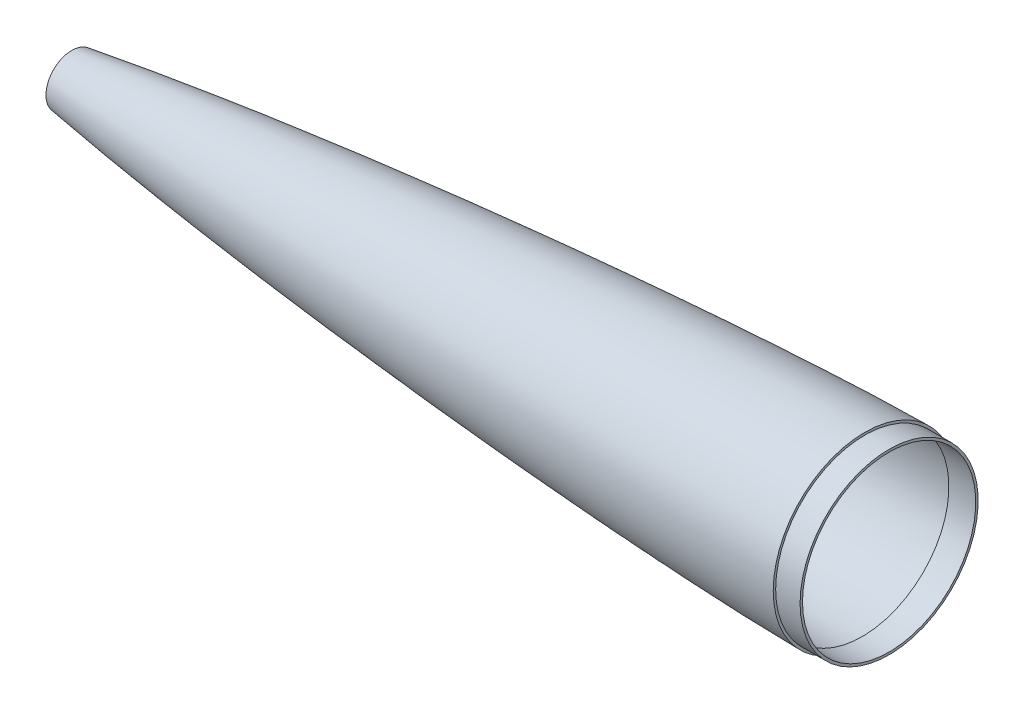
from build123d import *

# Parameters (mm, degrees)
CUT_EXTRUDE1_REACH = 680.348
SKETCH4_R          = 75


with BuildPart() as part:
    # Sketch2 → Revolve1 (revolve)
    with BuildSketch(Plane.XY):
        with BuildLine():
            Line((750.00497269, 75), (750, 75))
            add(Edge.make_bspline(
                [(0, 0), (0.002661369, 0.00735768), (0.009108664, 0.021455176), (0.026858739, 0.047022825), (0.06841925, 0.093346235), (0.131428409, 0.1510252), (0.216810716, 0.21833703), (0.338162364, 0.304110587), (0.48394243, 0.397396692), (0.655054985, 0.498068807), (0.851568565, 0.605626998), (1.137654509, 0.753350528), (1.581543682, 0.966113556), (2.335050733, 1.296122672), (3.682901567, 1.826629283), (6.111473252, 2.674476309), (10.574628301, 4.037968264), (18.951733743, 6.252001296), (33.570100518, 9.565304084), (58.406653249, 14.407879587), (92.507874052, 20.12088369), (133.842049801, 26.225056743), (179.809214733, 32.306451647), (225.84209313, 37.86321125), (271.925422623, 42.983912816), (318.04912254, 47.72529812), (364.207064366, 52.120679156), (410.394737335, 56.191009866), (456.609131982, 59.945893406), (502.84798368, 63.386478656), (549.109760477, 66.50424795), (595.393392595, 69.279792224), (635.910176338, 71.377324916), (670.6520208, 72.898528506), (698.66827638, 73.906563077), (717.52848444, 74.458019085), (733.022602025, 74.804058757), (742.723636447, 74.948033977), (747.57448889, 74.993969324), (750, 75)],
                knots=[0, 0, 0, 0, 0, 4.1103e-05, 8.2207e-05, 0.000164413, 0.000328826, 0.000493239, 0.000657652, 0.000951494, 0.001245335, 0.001544792, 0.001844249, 0.002657057, 0.00385252, 0.005901677, 0.009515863, 0.016280764, 0.028569004, 0.051793804, 0.088907366, 0.150314205, 0.211721038, 0.273127872, 0.334534706, 0.395941541, 0.457348376, 0.518755211, 0.580162046, 0.641568881, 0.702975716, 0.764382551, 0.825789386, 0.887196222, 0.917899639, 0.948603057, 0.974301528, 0.987150764, 1, 1, 1, 1, 1], degree=4))
            Line((0, 0), (17.824636248, 0))
            add(Edge.make_bspline(
                [(17.824636248, 0), (17.827359821, 0.007438315), (17.83394352, 0.021685181), (17.85200756, 0.047505996), (17.894329621, 0.094207173), (17.946659869, 0.141803874), (18.00793283, 0.191078994), (18.083660244, 0.247216772), (18.181771032, 0.315046273), (18.316852614, 0.400745464), (18.491162199, 0.502339064), (18.691437236, 0.610907618), (18.985657603, 0.761336609), (19.446495181, 0.979763892), (20.243699921, 1.324403347), (21.683492291, 1.881589923), (24.318644814, 2.782982784), (29.21451122, 4.240833208), (38.455862174, 6.611511049), (54.987751035, 10.230228493), (81.828623639, 15.247893158), (117.893812964, 21.05165355), (160.925453146, 27.155265251), (207.678359496, 33.103632305), (254.493219278, 38.533920173), (301.357126925, 43.530168516), (348.258583686, 48.144605296), (395.195517807, 52.408605556), (442.157521049, 56.340458763), (489.151953975, 59.947817327), (536.159738144, 63.228580383), (583.207792217, 66.170919541), (630.245909701, 68.74857003), (668.532144057, 70.510188265), (697.913196576, 71.631136519), (718.60463903, 72.282916745), (730.184819299, 72.607163808), (739.336592405, 72.821554583), (745.131881071, 72.938779632), (748, 72.991017275)],
                knots=[0, 0, 0, 0, 0, 4.1633e-05, 8.3266e-05, 0.000166533, 0.000333066, 0.000416332, 0.000499598, 0.000666131, 0.000965005, 0.00126388, 0.001568582, 0.001873283, 0.002716091, 0.003966064, 0.006170302, 0.010052999, 0.017472044, 0.031031254, 0.056720606, 0.099723243, 0.162163255, 0.224603279, 0.287043299, 0.349483318, 0.41192334, 0.474363361, 0.536803383, 0.599243404, 0.661683425, 0.724123446, 0.786563467, 0.849003488, 0.911443509, 0.927053514, 0.942663519, 0.958273524, 0.97388353, 0.97388353, 0.97388353, 0.97388353, 0.97388353], degree=4))
            Line((748, 72.991017275), (748, 71.000006182))
            Line((748, 71.000006182), (770.00497269, 71.000006182))
            Line((770.00497269, 71.000006182), (770.00497269, 73.000006182))
            Line((770.00497269, 73.000006182), (750.00497269, 73.000006182))
            Line((750.00497269, 73.000006182), (750.00497269, 75))
        make_face()
    revolve(axis=Axis((0, 0, 0), (1, 0, 0)))

    # Sketch4 → Cut-Extrude1 (cut, up to next)
    with BuildSketch(Plane(origin=(100, 0, 0), x_dir=(0, 0, -1), z_dir=(1, 0, 0)), mode=Mode.PRIVATE) as cut_extrude1_sk1:
        Circle(SKETCH4_R)
    cut_extrude1_tool1 = extrude(cut_extrude1_sk1.sketch, amount=-CUT_EXTRUDE1_REACH, mode=Mode.PRIVATE) & part.part
    add(cut_extrude1_tool1.solids().sort_by_distance((100, 0, 0))[0], mode=Mode.SUBTRACT)


solid = part.part
